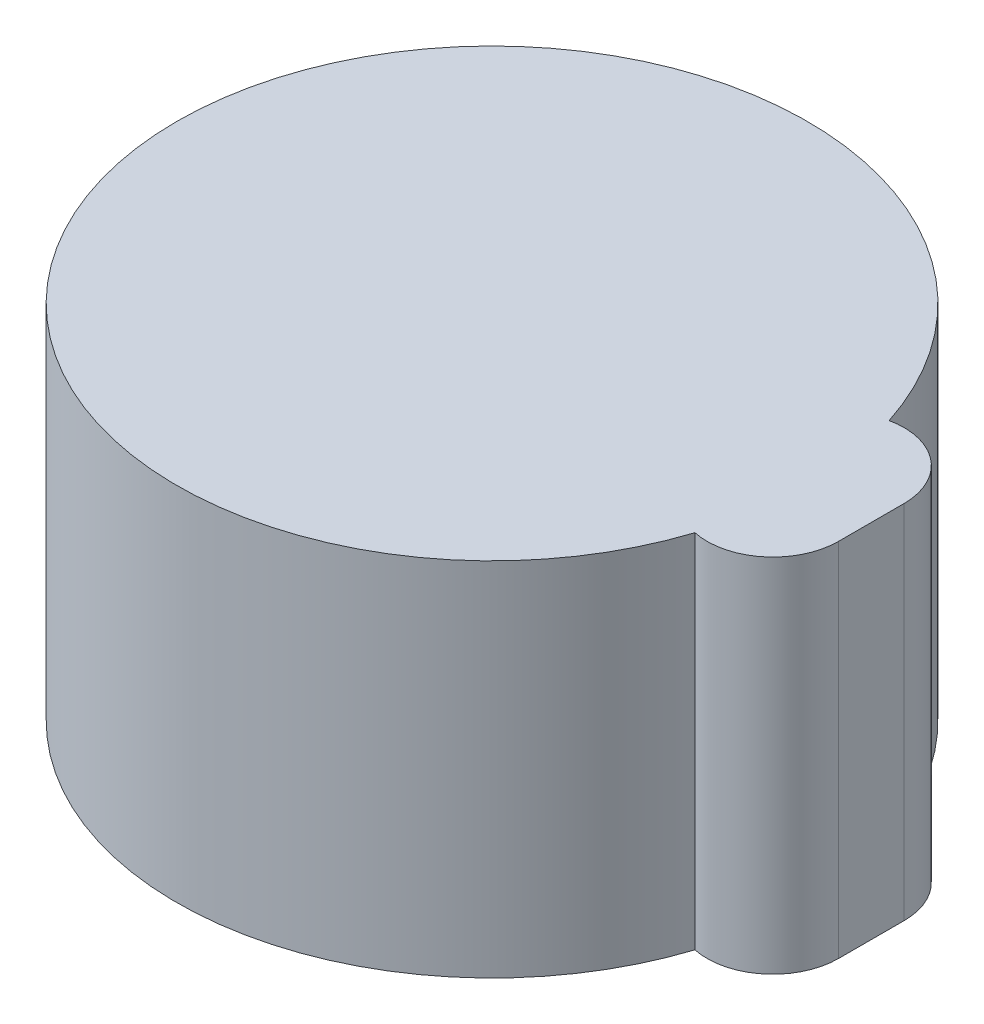
from build123d import *

# Parameters (mm, degrees)
BOSS_EXTRUDE1_DEPTH = 5
BOSS_EXTRUDE2_DEPTH = 0.5
BOSS_EXTRUDE3_START = 1
BOSS_EXTRUDE3_DEPTH = 1


with BuildPart() as part:
    # Sketch1 → Boss-Extrude1 (new body)
    with BuildSketch(Plane(origin=(0, 0, 0), x_dir=(1, 0, 0), z_dir=(0, 1, 0))):
        with BuildLine():
            ThreePointArc((5.773887305, 0.5), (5.403490366, 1.276916974), (4.566687335, 1.478298611))
            ThreePointArc((4.566687335, 1.478298611), (-4.8, 0), (4.566687335, -1.478298611))
            ThreePointArc((4.566687335, -1.478298611), (5.403490366, -1.276916974), (5.773887305, -0.5))
            Line((5.773887305, -0.5), (5.773887305, 0.5))
        make_face()
        with BuildLine():
            Line((5.273887305, 0.5), (5.273887305, -0.5))
            ThreePointArc((5.273887305, -0.5), (5.098728559, -0.880102828), (4.695974666, -0.993892317))
            Line((4.695974666, -0.993892317), (4.183560453, -0.993892317))
            ThreePointArc((4.183560453, -0.993892317), (-4.3, 0), (4.183560453, 0.993892317))
            Line((4.183560453, 0.993892317), (4.695974666, 0.993892317))
            ThreePointArc((4.695974666, 0.993892317), (5.098728559, 0.880102828), (5.273887305, 0.5))
        make_face(mode=Mode.SUBTRACT)
    extrude(amount=BOSS_EXTRUDE1_DEPTH)

    # Sketch3 → Boss-Extrude2 (add)
    with BuildSketch(Plane(origin=(0, 5, 0), x_dir=(1, 0, 0), z_dir=(0, 1, 0))):
        with BuildLine():
            Line((5.773887305, -0.5), (5.773887305, 0.5))
            ThreePointArc((5.773887305, 0.5), (5.403490366, 1.276916974), (4.566687335, 1.478298611))
            ThreePointArc((4.566687335, 1.478298611), (-4.8, 0), (4.566687335, -1.478298611))
            ThreePointArc((4.566687335, -1.478298611), (5.403490366, -1.276916974), (5.773887305, -0.5))
        make_face()
    extrude(amount=BOSS_EXTRUDE2_DEPTH)

    # Sketch4 → Boss-Extrude3 (add)
    with BuildSketch(Plane.XZ.offset(-5).offset(BOSS_EXTRUDE3_START)):
        with BuildLine():
            Line((3.667721099, 0.993892317), (4.183560453, 0.993892317))
            ThreePointArc((4.183560453, 0.993892317), (-4.3, 0), (4.183560453, -0.993892317))
            Line((4.183560453, -0.993892317), (3.667721099, -0.993892317))
            ThreePointArc((3.667721099, -0.993892317), (-3.8, 0), (3.667721099, 0.993892317))
        make_face()
    extrude(amount=-BOSS_EXTRUDE3_DEPTH)


solid = part.part
